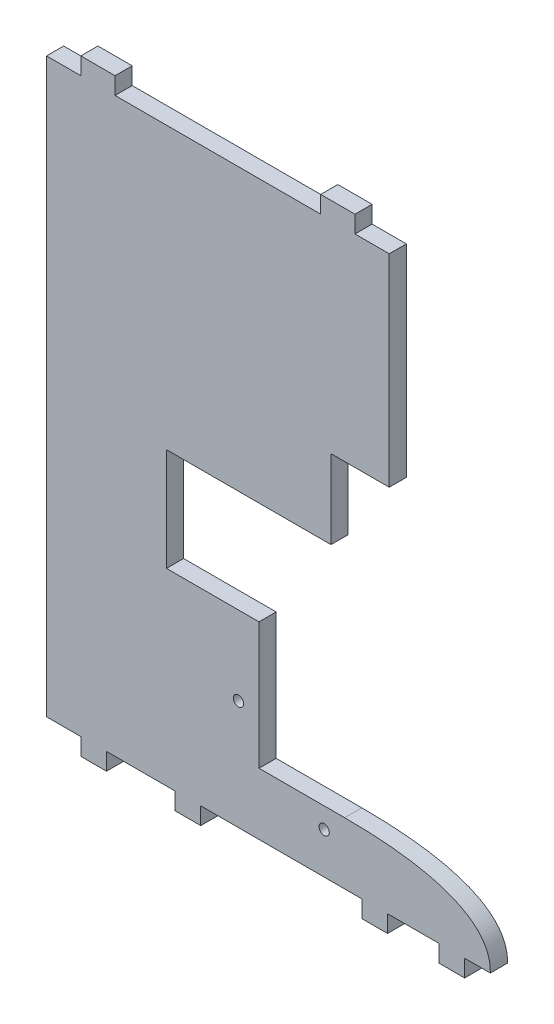
from build123d import *

# Parameters (mm, degrees)
ESQUISSE1_R        = 1.5
BOSS_EXTRU_1_DEPTH = 5
BOSS_EXTRU_2_DEPTH = 5


with BuildPart() as part:
    # Esquisse1 → Boss.-Extru.1 (new body)
    with BuildSketch(Plane.XY):
        Polygon((0, 0), (37, 0), (37, 18), (12, 18), (12, 55), (0, 55), align=None)
        with Locations((6, 32)):
            Circle(ESQUISSE1_R, mode=Mode.SUBTRACT)
        with Locations((31, 12)):
            Circle(ESQUISSE1_R, mode=Mode.SUBTRACT)
    extrude(amount=BOSS_EXTRU_1_DEPTH)

    # Esquisse2 → Boss.-Extru.2 (add)
    with BuildSketch(Plane.XY.offset(5)):
        with BuildLine():
            Line((37, 0), (42, 0))
            Line((42, 0), (42, -5))
            Line((42, -5), (49.5, -5))
            Line((49.5, -5), (49.5, 0))
            Line((49.5, 0), (64.5, 0))
            Line((64.5, 0), (64.5, -5))
            Line((64.5, -5), (72, -5))
            Line((72, -5), (72, 0))
            Line((72, 0), (79.5, 0))
            add(Edge.make_bspline(
                [(37, 18), (79.239532327, 18), (79.5, 3.874285435), (79.5, 0)],
                knots=[0, 0, 0, 0, 1, 1, 1, 1], degree=3))
            Line((37, 18), (37, 0))
        make_face()
        Polygon((0, 0), (-5, 0), (-5, -5), (-12.5, -5), (-12.5, 0), (-32.5, 0), (-32.5, -5), (-40, -5), (-40, 0), (-50, 0), (-50, 167), (-40, 167), (-40, 172), (-30, 172), (-30, 167), (30, 167), (30, 172), (40, 172), (40, 167), (50, 167), (50, 108), (33, 108), (33, 85), (-15, 85), (-15, 55), (0, 55), align=None)
    extrude(amount=-BOSS_EXTRU_2_DEPTH)


solid = part.part
